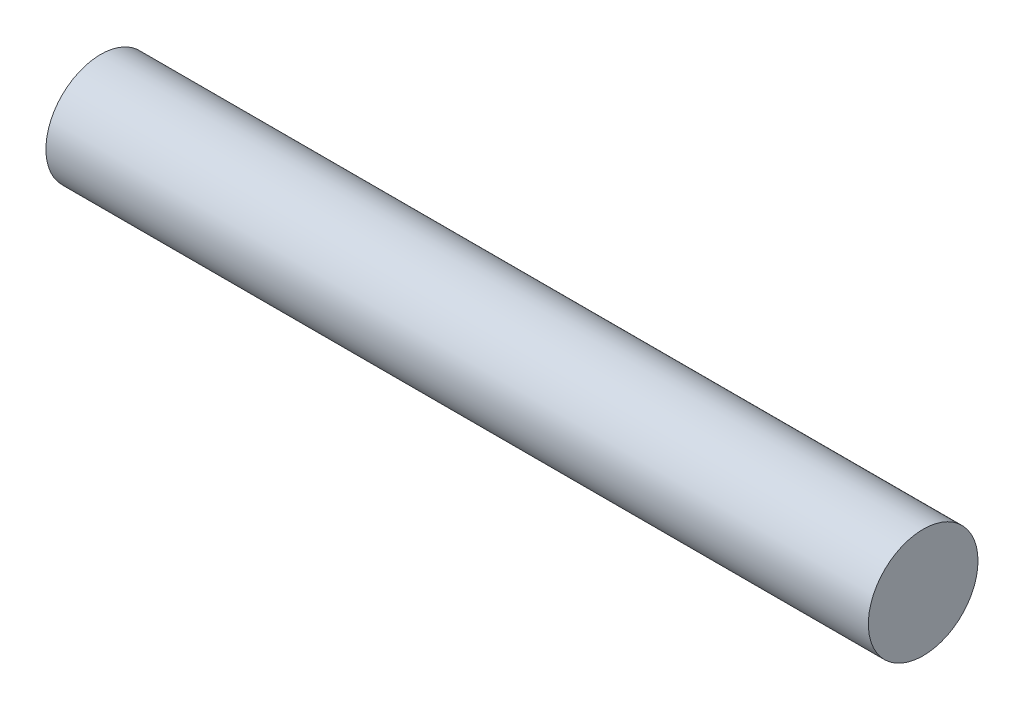
from build123d import *

# Parameters (mm, degrees)
PIN_TOP_SKETCH_R = 2
PIN_BODY_DEPTH   = 30


with BuildPart() as part:
    # Pin Top Sketch → Pin Body (new body)
    with BuildSketch(Plane(origin=(-624, 0, 0), x_dir=(0, 0, -1), z_dir=(1, 0, 0))):
        with Locations((0, 117.3)):
            Circle(PIN_TOP_SKETCH_R)
    extrude(amount=PIN_BODY_DEPTH)


solid = part.part
